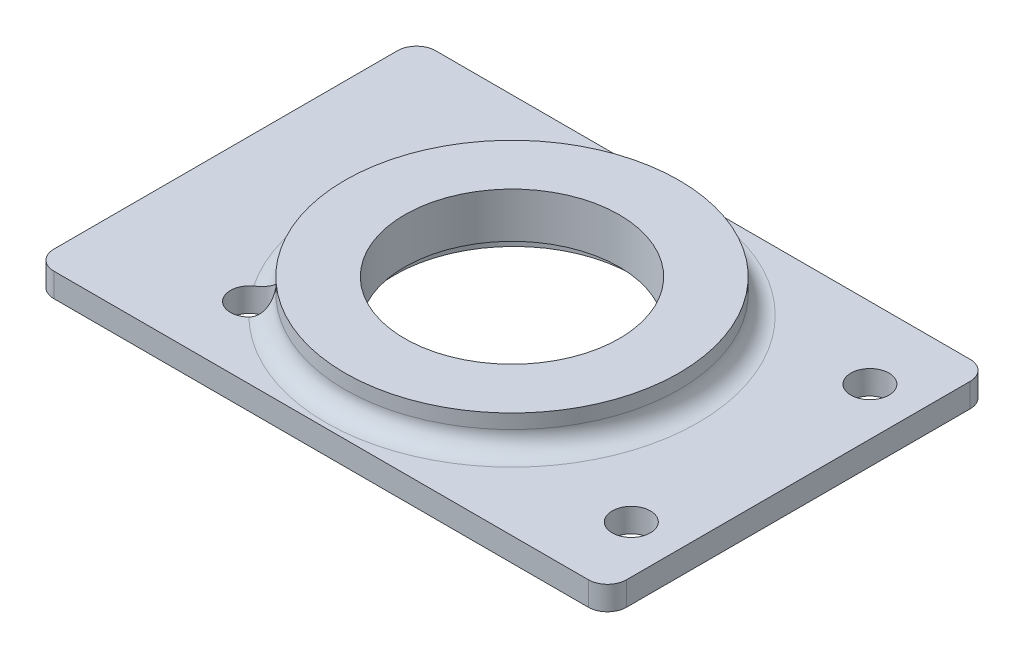
from build123d import *

# Parameters (mm, degrees)
SKETCH1_W               = 76.2
SKETCH1_H               = 50.8
SKETCH1_R               = 14.2748
BOSS_EXTRUDE1_DEPTH     = 3.175
SKETCH2_R               = 22.225
BOSS_EXTRUDE2_DEPTH     = 4.445
SKETCH3_R               = 14.2748
CUT_EXTRUDE1_DEPTH      = 92.688810795
SKETCH4_R               = 15.8623
CUT_EXTRUDE2_DEPTH      = 1.6002
FILLET1_R               = 2.54
FILLET2_R               = 2.54
CUT_EXTRUDE3_DEPTH      = 92.688810795
CUT_EXTRUDE3_DEPTH_BACK = 92.688810795
SKETCH5_R               = 2.54


with BuildPart() as part:
    # Sketch1 → Boss-Extrude1 (new body)
    with BuildSketch(Plane(origin=(0, 0, 0), x_dir=(1, 0, 0), z_dir=(0, 1, 0))):
        with Locations((38.1, 25.4)):
            Rectangle(SKETCH1_W, SKETCH1_H)
        with Locations((38.1, 25.4)):
            Circle(SKETCH1_R, mode=Mode.SUBTRACT)
    extrude(amount=BOSS_EXTRUDE1_DEPTH)

    # Sketch2 → Boss-Extrude2 (add)
    with BuildSketch(Plane(origin=(0, 3.175, 0), x_dir=(1, 0, 0), z_dir=(0, 1, 0))):
        with Locations((38.1, 25.4)):
            Circle(SKETCH2_R)
    extrude(amount=BOSS_EXTRUDE2_DEPTH)

    # Sketch3 → Cut-Extrude1 (cut, through all)
    with BuildSketch(Plane.XZ.offset(-3.175)):
        with Locations((38.1, -25.4)):
            Circle(SKETCH3_R)
    extrude(amount=-CUT_EXTRUDE1_DEPTH, mode=Mode.SUBTRACT)

    # Sketch4 → Cut-Extrude2 (cut)
    with BuildSketch(Plane(origin=(0, 0, 0), x_dir=(-1, 0, 0), z_dir=(0, -1, 0))):
        with Locations((-38.332507849, 25.4)):
            Circle(SKETCH4_R)
    extrude(amount=-CUT_EXTRUDE2_DEPTH, mode=Mode.SUBTRACT)

    # Fillet1
    fillet1_edges = [part.edges().sort_by_distance(p)[0] for p in [
        (15.875, 3.175, -25.4),
    ]]
    fillet(fillet1_edges, radius=FILLET1_R)

    # Fillet2
    fillet2_edges = [part.edges().sort_by_distance(p)[0] for p in [
        (0, 1.5875, -50.8),
        (76.2, 1.5875, -50.8),
        (0, 1.5875, 0),
        (76.2, 1.5875, 0),
    ]]
    fillet(fillet2_edges, radius=FILLET2_R)

    # Sketch5 → Cut-Extrude3 (cut, two sides: drawn at the far end of the back side and taken through both)
    with BuildSketch(Plane(origin=(0, 3.175, 0), x_dir=(1, 0, 0), z_dir=(0, 1, 0)).offset(-CUT_EXTRUDE3_DEPTH_BACK)):
        with Locations((69.85, 41.275)):
            Circle(SKETCH5_R)
        with Locations((69.85, 9.525)):
            Circle(SKETCH5_R)
        with Locations((19.05, 9.525)):
            Circle(SKETCH5_R)
        with Locations((19.05, 41.275)):
            Circle(SKETCH5_R)
    extrude(amount=CUT_EXTRUDE3_DEPTH + CUT_EXTRUDE3_DEPTH_BACK, mode=Mode.SUBTRACT)


solid = part.part
